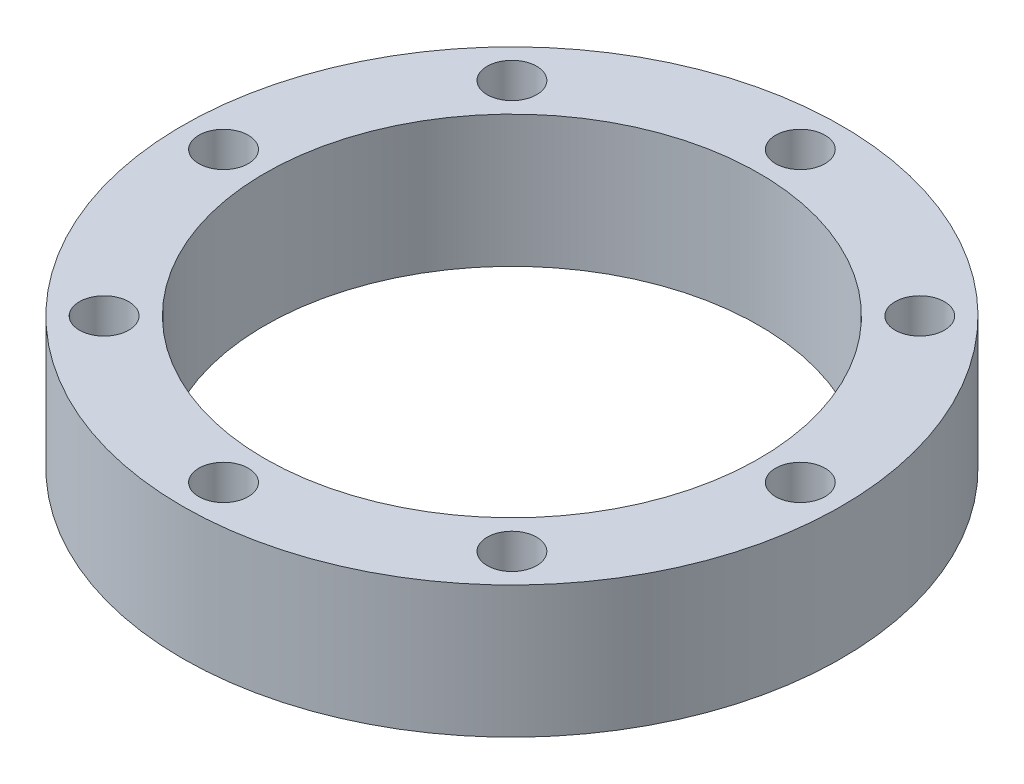
from build123d import *

# Parameters (mm, degrees)
SKETCH_1_R      = 20
SKETCH_1_R_2    = 15
SKETCH_1_R_3    = 1.5
EXTRUDE_1_DEPTH = 8


with BuildPart() as part:
    # 草图1 → 凸台-拉伸1 (new body)
    with BuildSketch(Plane(origin=(0, 0, 0), x_dir=(1, 0, 0), z_dir=(0, 1, 0))):
        Circle(SKETCH_1_R)
        Circle(SKETCH_1_R_2, mode=Mode.SUBTRACT)
        with Locations((0, 17.5)):
            Circle(SKETCH_1_R_3, mode=Mode.SUBTRACT)
        with Locations((12.374368671, 12.374368671)):
            Circle(SKETCH_1_R_3, mode=Mode.SUBTRACT)
        with Locations((17.5, 0)):
            Circle(SKETCH_1_R_3, mode=Mode.SUBTRACT)
        with Locations((12.374368671, -12.374368671)):
            Circle(SKETCH_1_R_3, mode=Mode.SUBTRACT)
        with Locations((0, -17.5)):
            Circle(SKETCH_1_R_3, mode=Mode.SUBTRACT)
        with Locations((-12.374368671, -12.374368671)):
            Circle(SKETCH_1_R_3, mode=Mode.SUBTRACT)
        with Locations((-17.5, 0)):
            Circle(SKETCH_1_R_3, mode=Mode.SUBTRACT)
        with Locations((-12.374368671, 12.374368671)):
            Circle(SKETCH_1_R_3, mode=Mode.SUBTRACT)
    extrude(amount=EXTRUDE_1_DEPTH)


solid = part.part
